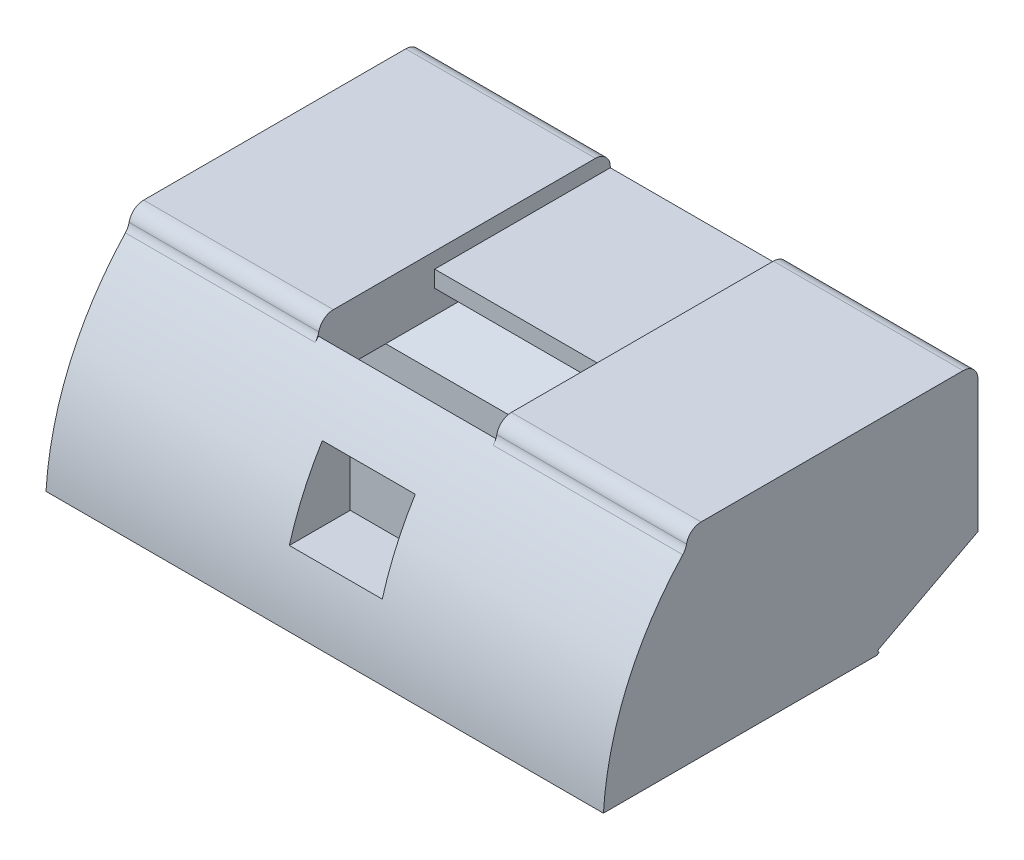
from build123d import *

# Parameters (mm, degrees)
BOSS_EXTRUDE1_DEPTH      = 150
BOSS_EXTRUDE1_DEPTH_BACK = 150
CUT_EXTRUDE3_DEPTH       = 375.5
CUT_EXTRUDE6_DEPTH       = 329
SKETCH9_W                = 271.336979698
SKETCH9_H                = 135.998838498
CUT_EXTRUDE9_DEPTH       = 30
SKETCH10_W               = 95.8
SKETCH10_H               = 62.546807737
CUT_EXTRUDE11_DEPTH      = 30
SKETCH11_W               = 102.1
SKETCH11_H               = 157.042427203
BOSS_EXTRUDE2_DEPTH      = 30
FILLET4_R                = 8
FILLET5_R                = 8
FILLET6_R                = 8
FILLET7_R                = 8
FILLET8_R                = 8
FILLET9_R                = 8
BOSS_EXTRUDE3_DEPTH      = 12
BOSS_EXTRUDE4_START      = -15
BOSS_EXTRUDE4_DEPTH      = 15
SKETCH17_W               = 271.728058528
SKETCH17_H               = 26.824087215
BOSS_EXTRUDE5_DEPTH      = 54
CUT_EXTRUDE14_DEPTH      = 21
CUT_EXTRUDE14_DEPTH_BACK = 21
SKETCH18_W               = 50
SKETCH18_H               = 40
CUT_EXTRUDE15_START      = -349
CUT_EXTRUDE15_DEPTH      = 349


with BuildPart() as part:
    # Sketch2 → Boss-Extrude1 (new, two sides: drawn at the far end of the back side and taken through both)
    with BuildSketch(Plane(origin=(0, 0, 0), x_dir=(0, 0, -1), z_dir=(1, 0, 0)).offset(-BOSS_EXTRUDE1_DEPTH_BACK)):
        with BuildLine():
            Line((47.021092325, 21.603077895), (47.021092325, -52.096922105))
            Line((47.021092325, -52.096922105), (-7.482950192, -79.488697318))
            Line((-7.482950192, -79.488697318), (-154.582950192, -79.488697318))
            ThreePointArc((-154.582950192, -79.488697318), (-141.2900932, -24.98088898), (-110.021334878, 21.603077895))
            Line((-110.021334878, 21.603077895), (47.021092325, 21.603077895))
        make_face()
    extrude(amount=BOSS_EXTRUDE1_DEPTH + BOSS_EXTRUDE1_DEPTH_BACK)

    # Sketch6 → Cut-Extrude3 (cut)
    with BuildSketch(Plane(origin=(150, 0, 0), x_dir=(0, 0, -1), z_dir=(1, 0, 0))):
        Polygon((47.021092325, -52.096922105), (47.021092325, -48.996922105), (-6.950510533, -77.430419395), (-6.23203774, -78.860033625), align=None)
    extrude(amount=-CUT_EXTRUDE3_DEPTH, mode=Mode.SUBTRACT)

    # Sketch8 → Cut-Extrude6 (cut)
    with BuildSketch(Plane(origin=(150, 0, 0), x_dir=(0, 0, -1), z_dir=(1, 0, 0))):
        with BuildLine():
            Line((-18.049462918, -65.128698573), (-139.30133294, -65.128698573))
            ThreePointArc((-139.30133294, -65.128698573), (-127.051990379, -22.399103161), (-99.746787758, 12.676395797))
            Line((-99.746787758, 12.676395797), (32.391473071, 12.676395797))
            Line((32.391473071, 12.676395797), (32.391473071, -41.004772665))
            Line((32.391473071, -41.004772665), (-18.049462918, -65.128698573))
        make_face()
    extrude(amount=-CUT_EXTRUDE6_DEPTH, mode=Mode.SUBTRACT)

    # Sketch9 → Cut-Extrude9 (cut)
    with BuildSketch(Plane.XZ.offset(79.488697318)):
        with Locations((1.940431321, 79.730726135)):
            Rectangle(SKETCH9_W, SKETCH9_H)
    extrude(amount=-CUT_EXTRUDE9_DEPTH, mode=Mode.SUBTRACT)

    # Sketch10 → Cut-Extrude11 (cut)
    with BuildSketch(Plane(origin=(0, 21.603077895, 0), x_dir=(1, 0, 0), z_dir=(0, 1, 0))):
        with Locations((0, -78.74793101)):
            Rectangle(SKETCH10_W, SKETCH10_H)
    extrude(amount=-CUT_EXTRUDE11_DEPTH, mode=Mode.SUBTRACT)

    # Sketch11 → Boss-Extrude2 (add)
    with BuildSketch(Plane(origin=(0, 0, 0), x_dir=(1, 0, 0), z_dir=(0, 1, 0))):
        with Locations((-98.95, -31.500121276)):
            Rectangle(SKETCH11_W, SKETCH11_H)
        with Locations((98.95, -31.500121276)):
            Rectangle(SKETCH11_W, SKETCH11_H)
    extrude(amount=BOSS_EXTRUDE2_DEPTH)

    # Fillet4
    fillet4_edges = [part.edges().sort_by_distance(p)[0] for p in [
        (-98.95, 30, 110.021334878),
    ]]
    fillet(fillet4_edges, radius=FILLET4_R)

    # Fillet5
    fillet5_edges = [part.edges().sort_by_distance(p)[0] for p in [
        (98.95, 30, 110.021334878),
    ]]
    fillet(fillet5_edges, radius=FILLET5_R)

    # Fillet6
    # the kernel refuses this fillet: 8 mm, written as the material it adds along each edge
    with BuildSketch(Plane(origin=(-150, 21.603077895, 110.021334878), x_dir=(0, -0.7256761067447404, 0.6880364729429655), z_dir=(1, 0, 0))) as fillet6_piece_1:
        with BuildLine():
            CenterArc((2.744889422, -7.999720666), FILLET6_R, 90.478801773, 31.768597775)
            Line((-1.523719625, -1.233704348), (-1.950580529, -0.557102717))
            ThreePointArc((-1.950580529, -0.557102717), (-0.838466066, 0.307444001), (-0.550429178, 0.580540885))
            Line((-0.550429178, 0.580540885), (0.006685256, 0.799972067))
            ThreePointArc((0.006685256, 0.799972067), (1.33901843, 0.794405102), (2.671351604, 0.799972067))
            Line((2.671351604, 0.799972067), (2.67803686, 0))
        make_face()
    extrude(amount=102.1)
    # the kernel refuses this fillet: 8 mm, written as the material it takes off along each edge

    # Fillet7
    # the kernel refuses this fillet: 8 mm, written as the material it adds along each edge
    with BuildSketch(Plane(origin=(47.9, 21.603077895, 110.021334878), x_dir=(0, 0.9969460846976341, -0.07809292033249748), z_dir=(1, 0, 0))) as fillet7_piece_1:
        with BuildLine():
            CenterArc((2.900642421, 7.944571871), FILLET7_R, 231.482877932, 31.768597775)
            Line((-2.081345425, 1.685195137), (-2.579544209, 1.059257463))
            ThreePointArc((-2.579544209, 1.059257463), (-1.540564119, 0.225193287), (-0.508590223, -0.617524077))
            Line((-0.508590223, -0.617524077), (0.062474336, -0.797556868))
            ThreePointArc((0.062474336, -0.797556868), (0.458184274, -0.766560061), (1.866538405, -0.794457187))
            Line((1.866538405, -0.794457187), (1.960547861, 0))
        make_face()
    extrude(amount=102.1)
    # the kernel refuses this fillet: 8 mm, written as the material it takes off along each edge

    # Fillet8
    fillet8_edges = [part.edges().sort_by_distance(p)[0] for p in [
        (98.95, 30, -47.021092325),
    ]]
    fillet(fillet8_edges, radius=FILLET8_R)

    # Fillet9
    fillet9_edges = [part.edges().sort_by_distance(p)[0] for p in [
        (-98.95, 30, -47.021092325),
    ]]
    fillet(fillet9_edges, radius=FILLET9_R)

    # Sketch13 → Boss-Extrude3 (add)
    with BuildSketch(Plane(origin=(150, 0, 0), x_dir=(0, 0, -1), z_dir=(1, 0, 0))):
        with BuildLine():
            Line((-139.30133294, -65.128698573), (-18.049462918, -65.128698573))
            Line((-18.049462918, -65.128698573), (32.391473071, -41.004772665))
            Line((32.391473071, -41.004772665), (32.391473071, 0))
            Line((32.391473071, 0), (-110.021334878, 0))
            Line((-110.021334878, 0), (-110.021334878, 2.512453321))
            ThreePointArc((-110.021334878, 2.512453321), (-130.12762054, -28.941917181), (-139.30133294, -65.128698573))
        make_face()
    extrude(amount=-BOSS_EXTRUDE3_DEPTH)

    # Sketch15 → Boss-Extrude4 (add)
    with BuildSketch(Plane.ZY.offset(150).offset(BOSS_EXTRUDE4_START)):
        with BuildLine():
            Line((-32.391473071, 0), (-32.391473071, -41.004772665))
            Line((-32.391473071, -41.004772665), (18.049462918, -65.128698573))
            Line((18.049462918, -65.128698573), (139.30133294, -65.128698573))
            ThreePointArc((139.30133294, -65.128698573), (130.12762054, -28.941917181), (110.021334878, 2.512453321))
            Line((110.021334878, 2.512453321), (110.021334878, 0))
            Line((110.021334878, 0), (-32.391473071, 0))
        make_face()
    extrude(amount=BOSS_EXTRUDE4_DEPTH)

    # Sketch17 → Boss-Extrude5 (add)
    with BuildSketch(Plane.XZ.offset(49.488697318)):
        with Locations((2.135970736, 123.433378486)):
            Rectangle(SKETCH17_W, SKETCH17_H)
    extrude(amount=-BOSS_EXTRUDE5_DEPTH)

    # Sketch18 → Cut-Extrude14 (cut, two sides: drawn at the far end of the back side and taken through both)
    with BuildSketch(Plane.XY.offset(136.845422093).offset(-CUT_EXTRUDE14_DEPTH_BACK)):
        with Locations((0, -25.17833284)):
            Rectangle(SKETCH18_W, SKETCH18_H)
    extrude(amount=CUT_EXTRUDE14_DEPTH + CUT_EXTRUDE14_DEPTH_BACK, mode=Mode.SUBTRACT)

    # Sketch20 → Cut-Extrude15 (cut)
    with BuildSketch(Plane(origin=(150, 0, 0), x_dir=(0, 0, -1), z_dir=(1, 0, 0)).offset(CUT_EXTRUDE15_START)):
        with BuildLine():
            Line((-136.845422093, 4.511302682), (-124.344519516, 4.511302682))
            ThreePointArc((-124.344519516, 4.511302682), (-130.970660544, -5.3695664), (-136.845422093, -15.714830799))
            Line((-136.845422093, -15.714830799), (-136.845422093, 4.511302682))
        make_face()
    extrude(amount=CUT_EXTRUDE15_DEPTH, mode=Mode.SUBTRACT)


solid = part.part
